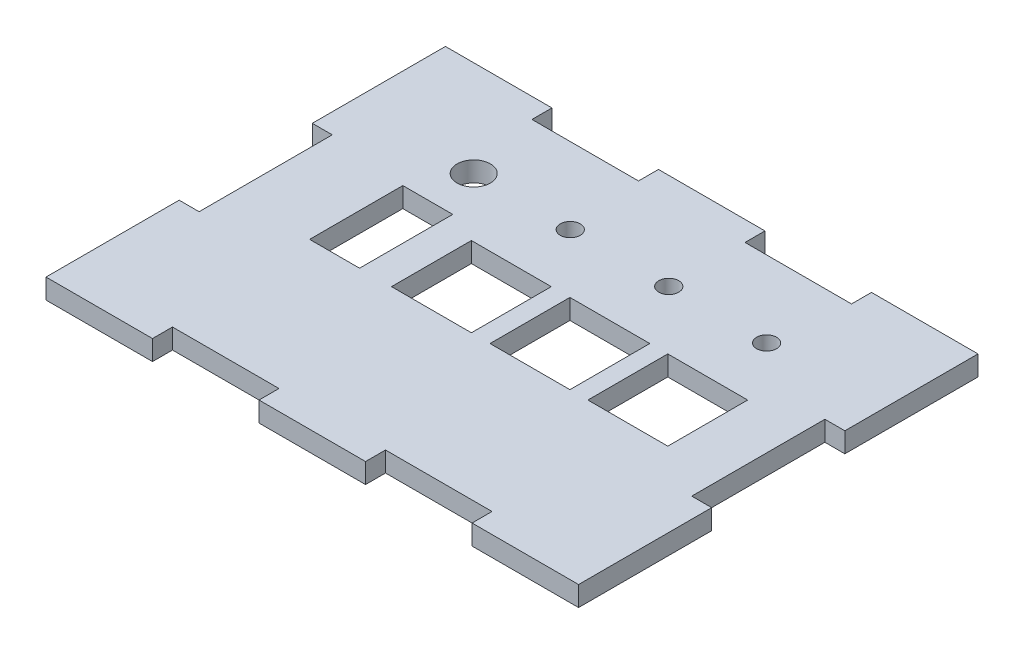
from build123d import *

# Parameters (mm, degrees)
TOP_AND_BOTTOM_R              = 1.5
TOP_AND_BOTTOM_R_2            = 2.5
TOP_AND_BOTTOM_W              = 12
TOP_AND_BOTTOM_H              = 12
TOP_AND_BOTTOM_W_2            = 7.5
TOP_AND_BOTTOM_H_2            = 14
TOP_AND_BOTTOM_EXTRUDED_DEPTH = 3


with BuildPart() as part:
    # Top and Bottom → Top and Bottom Extruded (new body)
    with BuildSketch(Plane(origin=(0, 0, 0), x_dir=(1, 0, 0), z_dir=(0, 1, 0))):
        Polygon((32, 60), (48, 60), (48, 57), (64, 57), (64, 60), (80, 60), (80, 40), (77, 40), (77, 20), (80, 20), (80, 0), (64, 0), (64, 3), (48, 3), (48, 0), (32, 0), (32, 3), (16, 3), (16, 0), (0, 0), (0, 20), (3, 20), (3, 40), (0, 40), (0, 60), (16, 60), (16, 57), (32, 57), align=None)
        with Locations((33.2, 45.55)):
            Circle(TOP_AND_BOTTOM_R, mode=Mode.SUBTRACT)
        with Locations((48, 45.55)):
            Circle(TOP_AND_BOTTOM_R, mode=Mode.SUBTRACT)
        with Locations((62.7, 45.55)):
            Circle(TOP_AND_BOTTOM_R, mode=Mode.SUBTRACT)
        with Locations((18.65, 45.6)):
            Circle(TOP_AND_BOTTOM_R_2, mode=Mode.SUBTRACT)
        with Locations((48, 30.7)):
            Rectangle(TOP_AND_BOTTOM_W, TOP_AND_BOTTOM_H, mode=Mode.SUBTRACT)
        with Locations((33.2, 30.7)):
            Rectangle(TOP_AND_BOTTOM_W, TOP_AND_BOTTOM_H, mode=Mode.SUBTRACT)
        with Locations((62.7, 30.7)):
            Rectangle(TOP_AND_BOTTOM_W, TOP_AND_BOTTOM_H, mode=Mode.SUBTRACT)
        with Locations((18.65, 31.7)):
            Rectangle(TOP_AND_BOTTOM_W_2, TOP_AND_BOTTOM_H_2, mode=Mode.SUBTRACT)
    extrude(amount=TOP_AND_BOTTOM_EXTRUDED_DEPTH)


solid = part.part
